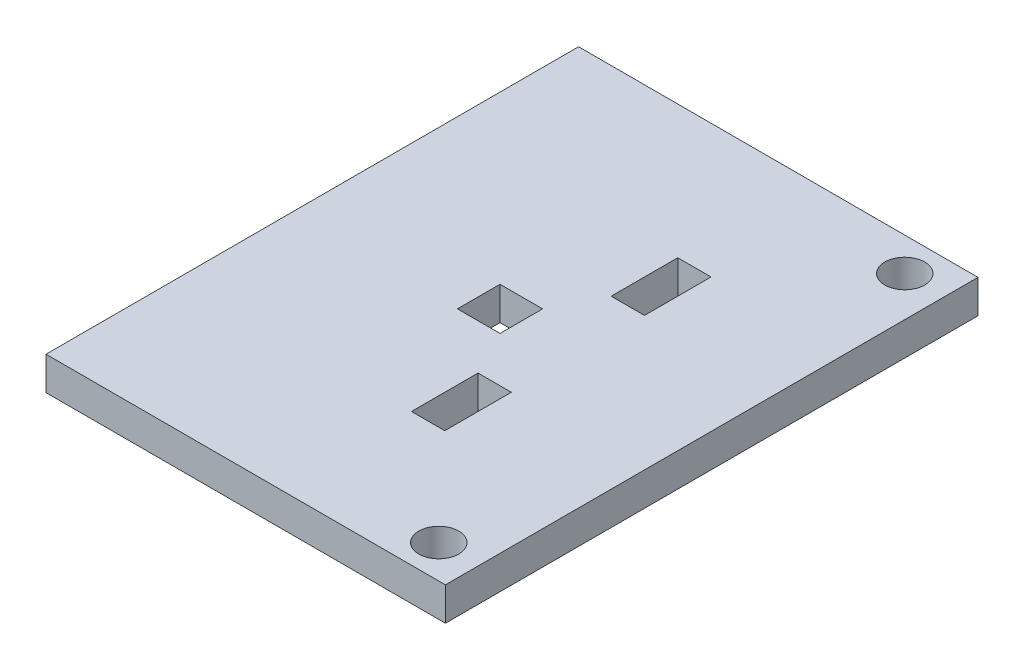
from build123d import *

# Parameters (mm, degrees)
SKETCH1_W           = 76.2
SKETCH1_H           = 101.6
BOSS_EXTRUDE1_DEPTH = 6.35
SKETCH2_R           = 3.81
SKETCH2_W           = 6.35
SKETCH2_H           = 12.7
SKETCH2_W_2         = 8.128
SKETCH2_H_2         = 8.128
CUT_EXTRUDE1_DEPTH  = 128.158650905


with BuildPart() as part:
    # Sketch1 → Boss-Extrude1 (new body)
    with BuildSketch(Plane(origin=(0, 0, 0), x_dir=(1, 0, 0), z_dir=(0, 1, 0))):
        with Locations((38.1, 50.8)):
            Rectangle(SKETCH1_W, SKETCH1_H)
    extrude(amount=BOSS_EXTRUDE1_DEPTH)

    # Sketch2 → Cut-Extrude1 (cut, through all)
    with BuildSketch(Plane(origin=(0, 6.35, 0), x_dir=(1, 0, 0), z_dir=(0, 1, 0))):
        with Locations((68.58, 95.25)):
            Circle(SKETCH2_R)
        with Locations((68.58, 6.35)):
            Circle(SKETCH2_R)
        with Locations((47.498, 69.85)):
            Rectangle(SKETCH2_W, SKETCH2_H)
        with Locations((47.498, 31.75)):
            Rectangle(SKETCH2_W, SKETCH2_H)
        with Locations((35.814, 50.8)):
            Rectangle(SKETCH2_W_2, SKETCH2_H_2)
    extrude(amount=-CUT_EXTRUDE1_DEPTH, mode=Mode.SUBTRACT)


solid = part.part
